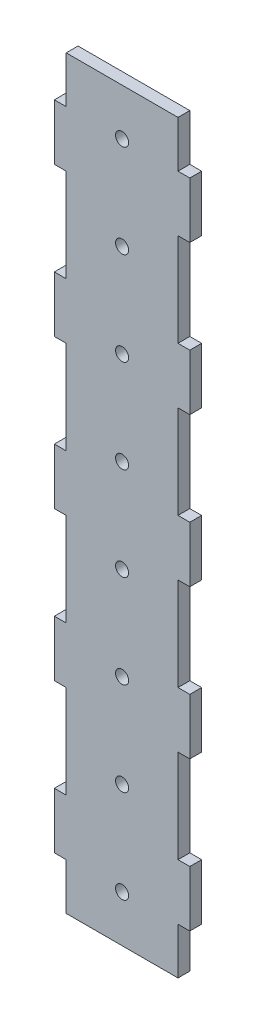
from build123d import *

# Parameters (mm, degrees)
SKETCH1_W          = 36.35
SKETCH1_H          = 200
SKETCH1_R          = 1.75
BASE_FLANGE1_DEPTH = 3.175
SKETCH2_W          = 3.175
SKETCH2_H          = 25
CUT_EXTRUDE1_DEPTH = 10
LPATTERN1_COUNT    = 6
LPATTERN1_PITCH    = 40


# Sheet-metal steps are written as plain solids
with BuildPart() as part:
    # Sketch1 → Base-Flange1 (new body)
    with BuildSketch(Plane.XY):
        with Locations((24.256146731, 10.708830738)):
            Rectangle(SKETCH1_W, SKETCH1_H)
        with Locations((24.256146731, 98.208830738)):
            Circle(SKETCH1_R, mode=Mode.SUBTRACT)
        with Locations((24.256146731, 73.208830738)):
            Circle(SKETCH1_R, mode=Mode.SUBTRACT)
        with Locations((24.256146731, 48.208830738)):
            Circle(SKETCH1_R, mode=Mode.SUBTRACT)
        with Locations((24.256146731, 23.208830738)):
            Circle(SKETCH1_R, mode=Mode.SUBTRACT)
        with Locations((24.256146731, -1.791169262)):
            Circle(SKETCH1_R, mode=Mode.SUBTRACT)
        with Locations((24.256146731, -26.791169262)):
            Circle(SKETCH1_R, mode=Mode.SUBTRACT)
        with Locations((24.256146731, -51.791169262)):
            Circle(SKETCH1_R, mode=Mode.SUBTRACT)
        with Locations((24.256146731, -76.791169262)):
            Circle(SKETCH1_R, mode=Mode.SUBTRACT)
    extrude(amount=-BASE_FLANGE1_DEPTH)

    # Sketch2 → Cut-Extrude1 (cut)
    with BuildSketch(Plane.XY):
        with Locations((7.668646731, -89.291169262)):
            Rectangle(SKETCH2_W, SKETCH2_H)
        with Locations((40.843646731, -89.291169262)):
            Rectangle(SKETCH2_W, SKETCH2_H)
    cut_extrude1 = extrude(amount=-CUT_EXTRUDE1_DEPTH, mode=Mode.SUBTRACT)

    # LPattern1: Cut-Extrude1 ×6
    with Locations(*[(0, i * LPATTERN1_PITCH, 0) for i in range(1, LPATTERN1_COUNT)]):
        add(cut_extrude1, mode=Mode.SUBTRACT)


solid = part.part
